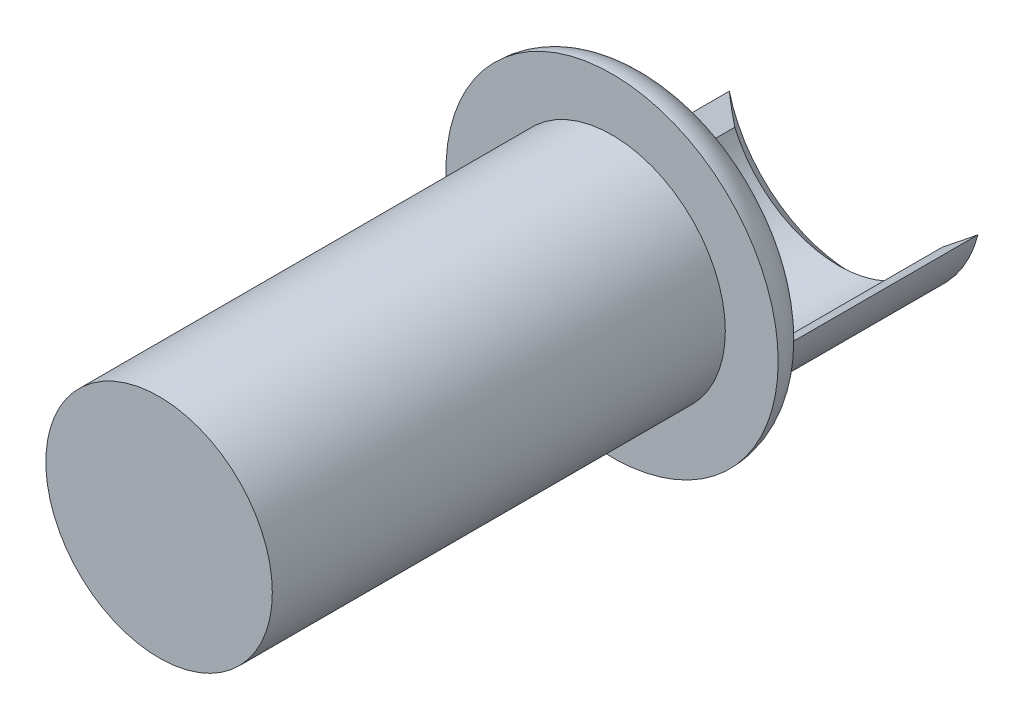
from build123d import *

# Parameters (mm, degrees)
ESQUISSE1_R             = 22
BOSS_EXTRU_1_DEPTH      = 5
ESQUISSE2_R             = 15
ENL_V_MAT_EXTRU_1_DEPTH = 5
ESQUISSE5_R             = 15
BOSS_EXTRU_3_DEPTH      = 60
BOSS_EXTRU_4_DEPTH      = 40
CONG_3_R                = 5
CHANFREIN3_SIZE         = 10


# Some blends are built 0.0001 mm under size
with BuildPart() as part:
    # Esquisse1 → Boss.-Extru.1 (new body)
    with BuildSketch(Plane.XY):
        Circle(ESQUISSE1_R)
    extrude(amount=BOSS_EXTRU_1_DEPTH)

    # Esquisse2 → Enlèv. mat.-Extru.1 (cut)
    with BuildSketch(Plane.XY.offset(5)):
        Circle(ESQUISSE2_R)
    extrude(amount=-ENL_V_MAT_EXTRU_1_DEPTH, mode=Mode.SUBTRACT)

    # Esquisse6 → Boss.-Extru.4 (add)
    with BuildSketch(Plane(origin=(0, 0, 5), x_dir=(-1, 0, 0), z_dir=(0, 0, -1))):
        with BuildLine():
            Line((17, 0), (15, 0))
            ThreePointArc((15, 0), (0, -15), (-15, 0))
            Line((-15, 0), (-17, 0))
            ThreePointArc((-17, 0), (0, -17), (17, 0))
        make_face()
    extrude(amount=BOSS_EXTRU_4_DEPTH)

    # Congé3
    cong_3_edges = [part.edges().sort_by_distance(p)[0] for p in [
        (-22, 0, 0),
    ]]
    fillet(cong_3_edges, radius=CONG_3_R - 0.0001)  # a hair under: the kernel refuses the full size

    # Chanfrein1
    # the kernel refuses this chamfer: 10 mm, written as the material it takes off along each edge
    with BuildSketch(Plane(origin=(-15, 0, 0), x_dir=(-0.9996473593715249, 0.026554790557210644, 0), z_dir=(0, 0, -1))) as chanfrein1_piece_1:
        with BuildLine():
            Line((7.910088072, -0.210124831), (-1.411160056, -5.964630311))
            ThreePointArc((-1.411160056, -5.964630311), (-0.431948163, -3.196946743), (0, 0))
            Line((0, 0), (7.910088072, -0.210124831))
        make_face()
    extrude(amount=55.626129825, mode=Mode.SUBTRACT)

    # Chanfrein2
    # the kernel refuses this chamfer: 10 mm, written as the material it takes off along each edge
    with BuildSketch(Plane(origin=(15, 0, 0), x_dir=(-0.24724932130112434, -0.9689518941186571, 0), z_dir=(0, 0, -1))) as chanfrein2_piece_1:
        with BuildLine():
            Line((6.123334993, -0.270103715), (-1.956453832, -7.667198586))
            Line((-1.956453832, -7.667198586), (0, 0))
            ThreePointArc((0, 0), (3.193480576, -0.45686924), (6.123334993, -0.270103715))
        make_face()
    extrude(amount=55.626129825, mode=Mode.SUBTRACT)

    # Chanfrein3
    # the kernel refuses this chamfer: 10 mm, written as the material it takes off along each edge
    with BuildSketch(Plane(origin=(0, 0, -35), x_dir=(-0.2632185213229825, 0.9647362385815837, 0), z_dir=(0.9647362385815837, 0.2632185213229825, 0))) as chanfrein3_piece_1:
        Polygon((15, CHANFREIN3_SIZE), (15 + CHANFREIN3_SIZE, 0), (15, 0), align=None)
    revolve(axis=Axis((0, 0, -35), (0, 0, 1)), revolution_arc=329.477752243, mode=Mode.SUBTRACT)


with BuildPart() as body_2:
    # Esquisse5 → Boss.-Extru.3 (new body)
    with BuildSketch(Plane.XY.offset(5)):
        Circle(ESQUISSE5_R)
    extrude(amount=BOSS_EXTRU_3_DEPTH)


solid = Compound([part.part, body_2.part])
